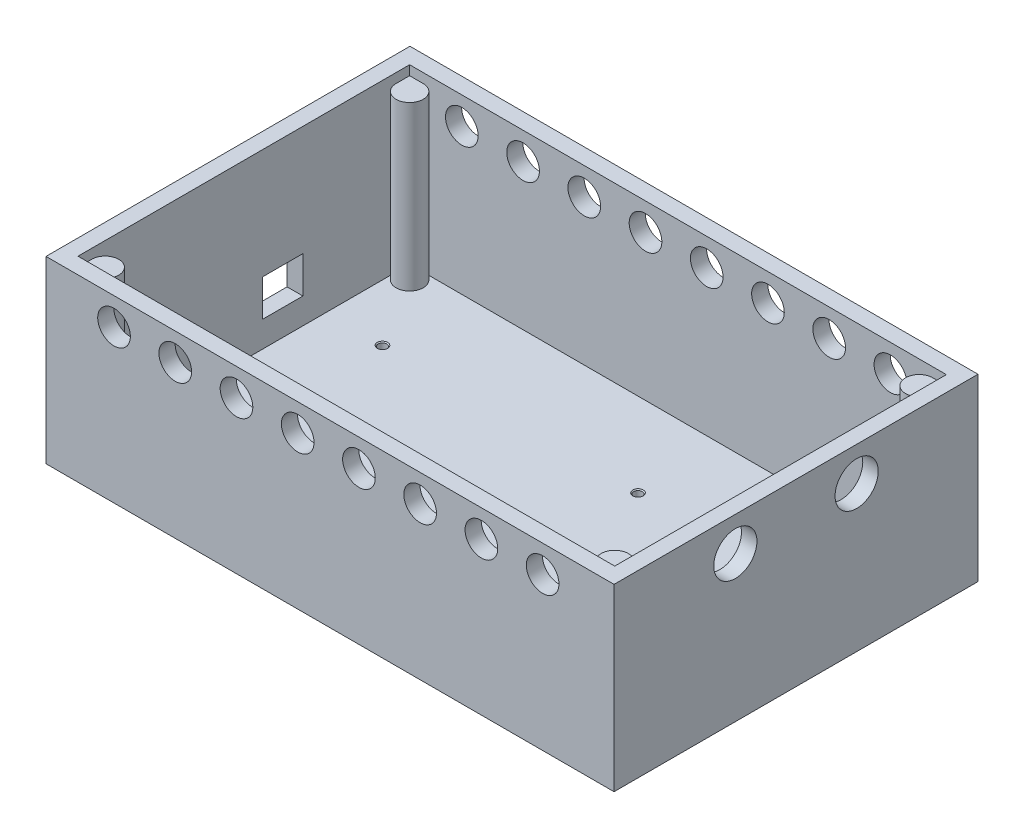
from build123d import *

# Parameters (mm, degrees)
SKETCH1_W                   = 167
SKETCH1_H                   = 107
BOSS_EXTRUDE1_DEPTH         = 52.8
SKETCH2_W                   = 157.8
SKETCH2_H                   = 97.5
CUT_EXTRUDE1_DEPTH          = 50.8
SKETCH3_R                   = 4.8
CUT_EXTRUDE2_DEPTH          = 154.262620335
LPATTERN1_COUNT             = 8
LPATTERN1_PITCH             = 18
CUT_EXTRUDE3_REACH          = 188.547
SKETCH4_R                   = 6.35
LPATTERN2_COUNT             = 2
LPATTERN2_PITCH             = 35.66
CUT_EXTRUDE4_REACH          = 188.547
SKETCH5_W                   = 11.94
SKETCH5_H                   = 10.8
BOSS_EXTRUDE5_DEPTH         = 48
M3_TAPPED_HOLE1_D           = 2.5
M3_TAPPED_HOLE1_CSINK_D     = 3.05
M3_TAPPED_HOLE1_CSINK_ANGLE = 90


with BuildPart() as part:
    # Sketch1 → Boss-Extrude1 (new body)
    with BuildSketch(Plane(origin=(0, 0, 0), x_dir=(1, 0, 0), z_dir=(0, 1, 0))):
        with Locations((-12.690388251, -10.711139896)):
            Rectangle(SKETCH1_W, SKETCH1_H)
    extrude(amount=BOSS_EXTRUDE1_DEPTH)

    # Sketch2 → Cut-Extrude1 (cut)
    with BuildSketch(Plane(origin=(0, 52.8, 0), x_dir=(1, 0, 0), z_dir=(0, 1, 0))):
        with Locations((-12.640388251, -10.711139896)):
            Rectangle(SKETCH2_W, SKETCH2_H)
    extrude(amount=-CUT_EXTRUDE1_DEPTH, mode=Mode.SUBTRACT)

    # Sketch3 → Cut-Extrude2 (cut, through all)
    with BuildSketch(Plane.XY.offset(64.211139896)):
        with Locations((-76.190388251, 44.8)):
            Circle(SKETCH3_R)
    cut_extrude2 = extrude(amount=-CUT_EXTRUDE2_DEPTH, mode=Mode.SUBTRACT)

    # LPattern1: Cut-Extrude2 ×8
    with Locations(*[(i * LPATTERN1_PITCH, 0, 0) for i in range(1, LPATTERN1_COUNT)]):
        add(cut_extrude2, mode=Mode.SUBTRACT)

    # Sketch4 → Cut-Extrude3 (cut, up to next)
    with BuildSketch(Plane(origin=(70.809611749, 0, 0), x_dir=(0, 0, -1), z_dir=(1, 0, 0)), mode=Mode.PRIVATE) as cut_extrude3_sk1:
        with Locations((-28.551139896, 42.8)):
            Circle(SKETCH4_R)
    cut_extrude3_tool1 = extrude(cut_extrude3_sk1.sketch, amount=-CUT_EXTRUDE3_REACH, mode=Mode.PRIVATE) & part.part
    cut_extrude3 = cut_extrude3_tool1.solids().sort_by_distance((70.809612, 42.8, 28.55114))[0]
    add(cut_extrude3, mode=Mode.SUBTRACT)

    # LPattern2: Cut-Extrude3 ×2
    with Locations(*[(0, 0, -i * LPATTERN2_PITCH) for i in range(1, LPATTERN2_COUNT)]):
        add(cut_extrude3, mode=Mode.SUBTRACT)

    # Sketch5 → Cut-Extrude4 (cut, up to next)
    with BuildSketch(Plane.ZY.offset(96.190388251), mode=Mode.PRIVATE) as cut_extrude4_sk1:
        with Locations((-0.698860104, 15)):
            Rectangle(SKETCH5_W, SKETCH5_H)
    cut_extrude4_tool1 = extrude(cut_extrude4_sk1.sketch, amount=-CUT_EXTRUDE4_REACH, mode=Mode.PRIVATE) & part.part
    add(cut_extrude4_tool1.solids().sort_by_distance((-96.190388, 15, -0.69886))[0], mode=Mode.SUBTRACT)

    # Sketch6 → Boss-Extrude5 (add)
    with BuildSketch(Plane(origin=(0, 2, 0), x_dir=(1, 0, 0), z_dir=(0, 1, 0))):
        with BuildLine():
            Line((66.259611749, 34.038860104), (66.259611749, 38.038860104))
            Line((66.259611749, 38.038860104), (62.259611749, 38.038860104))
            ThreePointArc((62.259611749, 38.038860104), (59.431184624, 31.210432979), (66.259611749, 34.038860104))
        make_face()
        with BuildLine():
            Line((66.259611749, -59.461139896), (62.259611749, -59.461139896))
            ThreePointArc((62.259611749, -59.461139896), (59.431184624, -52.632712772), (66.259611749, -55.461139896))
            Line((66.259611749, -55.461139896), (66.259611749, -59.461139896))
        make_face()
        with BuildLine():
            Line((-91.540388251, 38.038860104), (-87.540388251, 38.038860104))
            ThreePointArc((-87.540388251, 38.038860104), (-84.711961126, 31.210432979), (-91.540388251, 34.038860104))
            Line((-91.540388251, 34.038860104), (-91.540388251, 38.038860104))
        make_face()
        with BuildLine():
            Line((-91.540388251, -55.461139896), (-91.540388251, -59.461139896))
            Line((-91.540388251, -59.461139896), (-87.540388251, -59.461139896))
            ThreePointArc((-87.540388251, -59.461139896), (-84.711961126, -52.632712772), (-91.540388251, -55.461139896))
        make_face()
    extrude(amount=BOSS_EXTRUDE5_DEPTH)

    # M3 Tapped Hole1 (through all)
    with Locations(Plane(origin=(-49.02040068, 2, -140.944816831), x_dir=(1, 0, 0), z_dir=(0, 1, 0))):
        with Locations((56.769595429, -175.881156727), (25.768895429, -171.002663961), (-25.856604571, -175.881156727), (-25.856604571, -127.544956727), (49.276595429, -127.544956727)):
            CounterSinkHole(M3_TAPPED_HOLE1_D / 2, M3_TAPPED_HOLE1_CSINK_D / 2, counter_sink_angle=M3_TAPPED_HOLE1_CSINK_ANGLE)


solid = part.part
